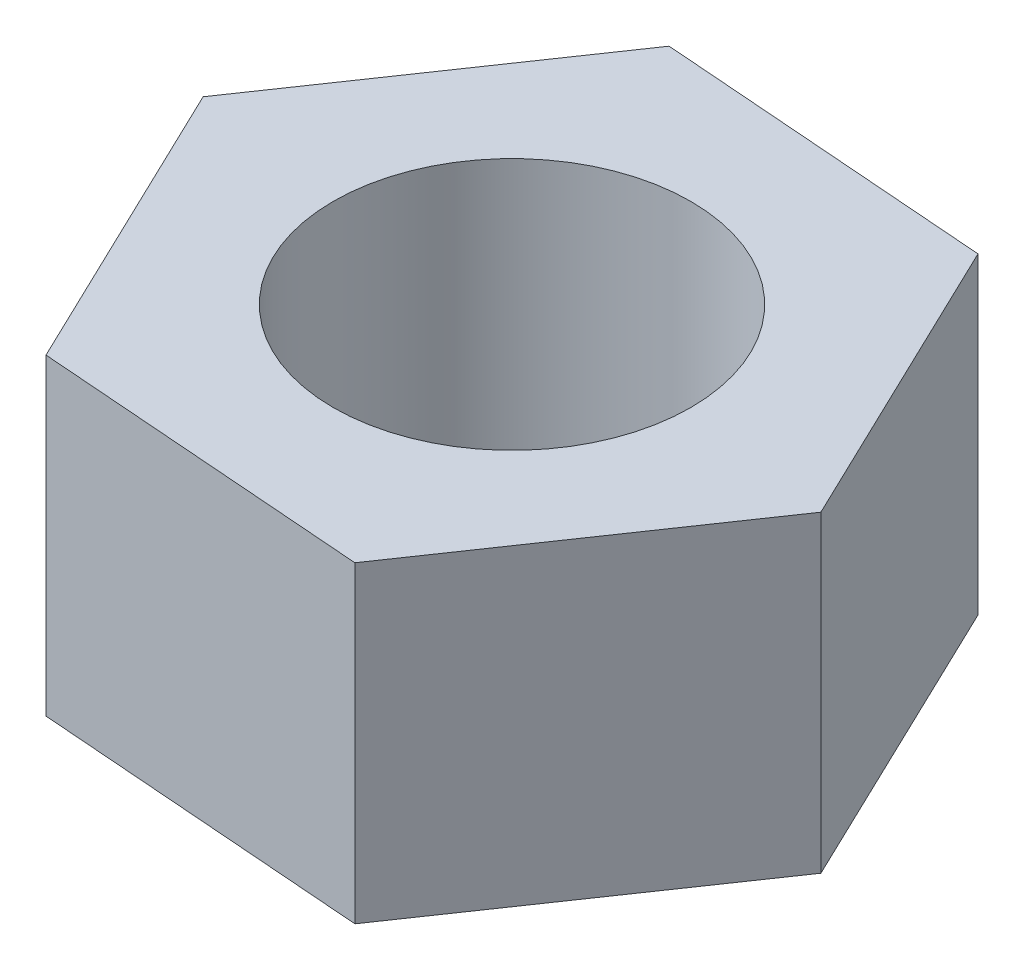
from build123d import *

# Parameters (mm, degrees)
SKETCH_1_R      = 4
EXTRUDE_1_DEPTH = 7


with BuildPart() as part:
    # Эскиз1 → Вытянуть1 (new body)
    with BuildSketch(Plane(origin=(0, 0, 0), x_dir=(1, 0, 0), z_dir=(0, 1, 0))):
        Polygon((3.248877823, -6.76595346), (7.483926489, -0.569366002), (4.235048666, 6.196587458), (-3.248877823, 6.76595346), (-7.483926489, 0.569366002), (-4.235048666, -6.196587458), align=None)
        Circle(SKETCH_1_R, mode=Mode.SUBTRACT)
    extrude(amount=EXTRUDE_1_DEPTH)


solid = part.part
